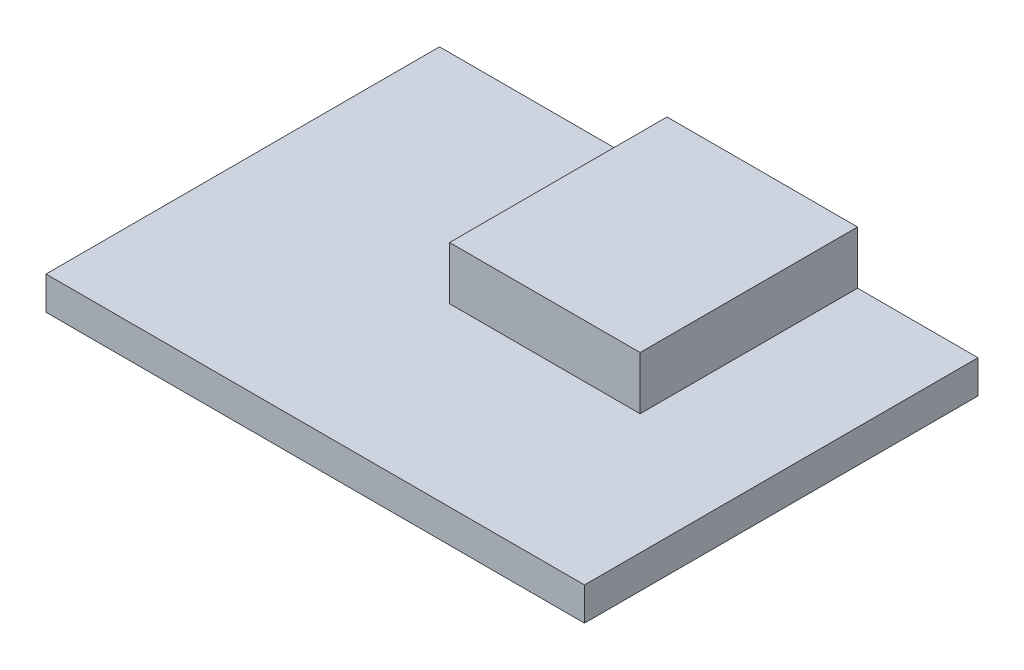
from build123d import *

# Parameters (mm, degrees)
SKETCH1_W           = 26
SKETCH1_H           = 19
BOSS_EXTRUDE1_DEPTH = 1.6
SKETCH2_W           = 9.2
SKETCH2_H           = 10.5
BOSS_EXTRUDE2_DEPTH = 2.56


with BuildPart() as part:
    # Sketch1 → Boss-Extrude1 (new body)
    with BuildSketch(Plane(origin=(0, 0, 0), x_dir=(1, 0, 0), z_dir=(0, 1, 0))):
        Rectangle(SKETCH1_W, SKETCH1_H)
    extrude(amount=BOSS_EXTRUDE1_DEPTH)

    # Sketch2 → Boss-Extrude2 (add)
    with BuildSketch(Plane(origin=(0, 1.6, 0), x_dir=(1, 0, 0), z_dir=(0, 1, 0))):
        with Locations((2.584875258, 4.25)):
            Rectangle(SKETCH2_W, SKETCH2_H)
    extrude(amount=BOSS_EXTRUDE2_DEPTH)


solid = part.part
